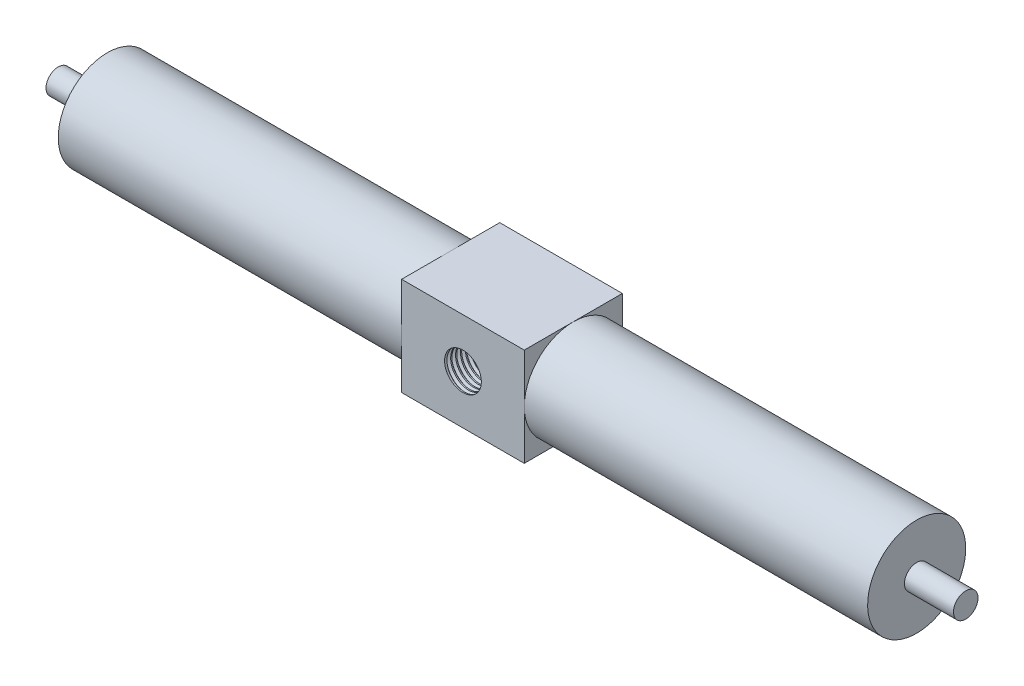
from build123d import *

# Parameters (mm, degrees)
SKETCH4_W           = 50
SKETCH4_H           = 40
BOSS_EXTRUDE2_DEPTH = 20
SKETCH5_R           = 7.5
CUT_EXTRUDE2_DEPTH  = 58
THREAD2_PITCH       = 2


with BuildPart() as part:
    # Sketch1 → Revolve2 (revolve)
    with BuildSketch(Plane.XY):
        Polygon((203.667591186, 133.430928626), (-166.332408814, 133.430928626), (-166.332408814, 138.430928626), (-146.332408814, 138.430928626), (-146.332408814, 153.430928626), (183.667591186, 153.430928626), (183.667591186, 138.430928626), (203.667591186, 138.430928626), align=None)
    revolve(axis=Axis((203.667591186, 133.430928626, 0), (-1, 0, 0)))

    # Sketch4 → Boss-Extrude2 (add, symmetric)
    with BuildSketch(Plane.XY):
        with Locations((18.667591186, 133.430928626)):
            Rectangle(SKETCH4_W, SKETCH4_H)
    extrude(amount=BOSS_EXTRUDE2_DEPTH, both=True)

    # Sketch5 → Cut-Extrude2 (cut)
    with BuildSketch(Plane.XY.offset(20)):
        with Locations((18.667591186, 133.430928626)):
            Circle(SKETCH5_R)
    extrude(amount=-CUT_EXTRUDE2_DEPTH, mode=Mode.SUBTRACT)

    # Thread2: the profile of Thread Profile2 profile screwed along a right-hand helix of 20 turns, 10 arcs to a turn; built about Z, then put on its axis
    thread2_z = Axis((0, 0, 0), (0, 0, 1))
    thread2_corners = [(7.4997, 0, -0.000173205), (8.58253175, 0, 0.624999997), (8.58253175, 0, 0.874999997), (7.4997, 0, 1.5001732)]
    with BuildLine(mode=Mode.PRIVATE) as thread2_profile:
        Line(thread2_corners[0], thread2_corners[1])
        Line(thread2_corners[1], thread2_corners[2])
        Line(thread2_corners[2], thread2_corners[3])
        Line(thread2_corners[3], thread2_corners[0])
    thread2_cap = Face(thread2_profile.wire())
    thread2_turn_angles = [0, 18, 36, 54, 72, 90, 108, 126, 144, 162, 180, 198, 216, 234, 252, 270, 288, 306, 324, 342, 360]
    thread2_turn_weights = [1, 0.9510565162951535, 1, 0.9510565162951535, 1, 0.9510565162951535, 1, 0.9510565162951535, 1, 0.9510565162951535, 1, 0.9510565162951535, 1, 0.9510565162951535, 1, 0.9510565162951535, 1, 0.9510565162951535, 1, 0.9510565162951535, 1]
    thread2_turn_rails = [Edge.make_bspline([Vector(p[0], p[1], 0).rotate(thread2_z, thread2_turn_angles[k]) / thread2_turn_weights[k] + Vector(0, 0, p[2] + THREAD2_PITCH * thread2_turn_angles[k] / 360) for k in range(21)], [0, 0, 0, 1, 1, 2, 2, 3, 3, 4, 4, 5, 5, 6, 6, 7, 7, 8, 8, 9, 9, 10, 10, 10], 2, thread2_turn_weights) for p in thread2_corners]
    thread2_turn_sides = [Face.make_surface_from_curves(thread2_turn_rails[p[0]], thread2_turn_rails[p[1]]) for p in [(0, 1), (1, 2), (2, 3), (3, 0)]]
    thread2 = Plane(origin=(18.667591186, 133.430928626, 20), x_dir=(1, 0, 0), z_dir=(0, 0, -1)) * Solid(Shell([*[p.moved(Location((0, 0, THREAD2_PITCH * i))) for i in range(20) for p in thread2_turn_sides], thread2_cap, thread2_cap.rotate(thread2_z, 7200).moved(Location((0, 0, THREAD2_PITCH * 7200 / 360)))]))
    add(thread2, mode=Mode.SUBTRACT)


solid = part.part
